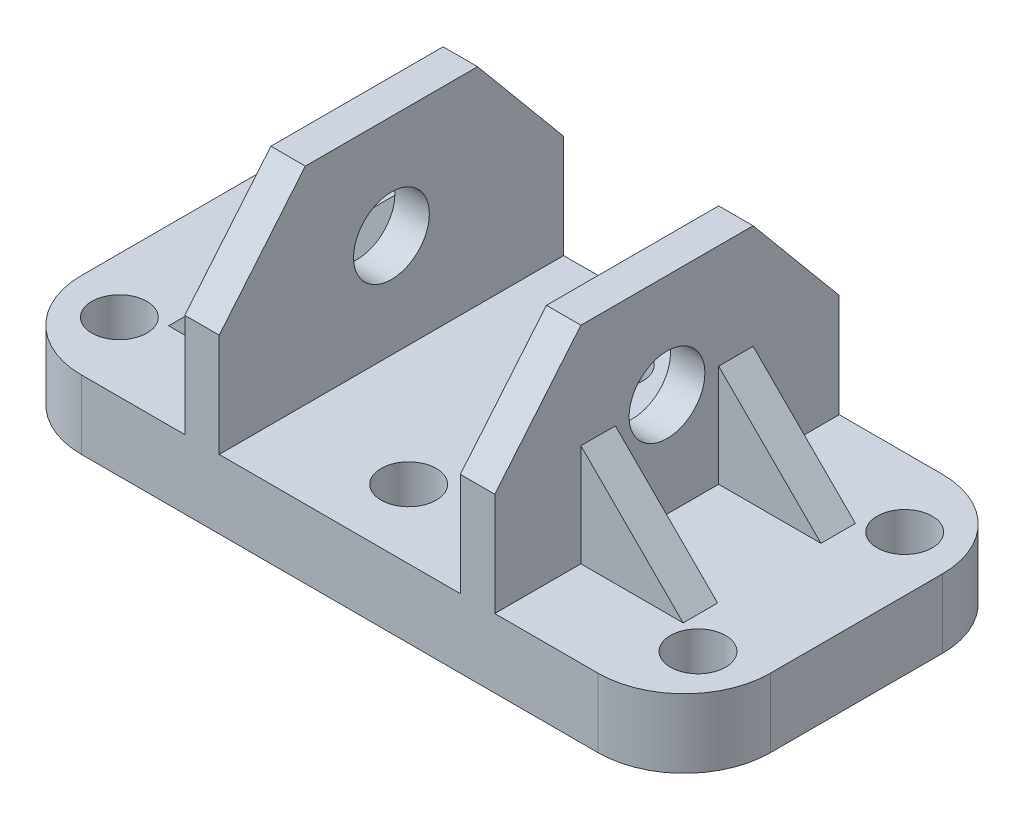
from build123d import *
from OCP.BRepFilletAPI import BRepFilletAPI_MakeChamfer

# Parameters (mm, degrees)
SKETCH2_W           = 200
SKETCH2_H           = 100
BOSS_EXTRUDE1_DEPTH = 20
FILLET1_R           = 25
SKETCH3_R           = 8
CUT_EXTRUDE2_DEPTH  = 20
SKETCH4_W           = 10
SKETCH4_H           = 100
BOSS_EXTRUDE3_DEPTH = 80
CHAMFER1_SIZE       = 30
CHAMFER1_SIZE2      = 25
SKETCH5_R           = 11
CUT_EXTRUDE3_DEPTH  = 127
SKETCH8_W           = 30.69541184
SKETCH8_H           = 10
BOSS_EXTRUDE4_DEPTH = 30
CHAMFER2_SIZE       = 31


with BuildPart() as part:
    # Sketch2 → Boss-Extrude1 (new body)
    with BuildSketch(Plane(origin=(0, 0, 0), x_dir=(1, 0, 0), z_dir=(0, 1, 0))):
        Rectangle(SKETCH2_W, SKETCH2_H)
    extrude(amount=BOSS_EXTRUDE1_DEPTH)

    # Fillet1
    fillet1_edges = [part.edges().sort_by_distance(p)[0] for p in [
        (100, 10, 50),
        (-100, 10, 50),
        (-100, 10, -50),
        (100, 10, -50),
    ]]
    fillet(fillet1_edges, radius=FILLET1_R)

    # Sketch3 → Cut-Extrude2 (cut)
    with BuildSketch(Plane(origin=(0, 20, 0), x_dir=(1, 0, 0), z_dir=(0, 1, 0))):
        with Locations(Location((-84, -30, 0), (0, 0, 270))):
            Circle(SKETCH3_R)
        with Locations(Location((84, -30, 0), (0, 0, 270))):
            Circle(SKETCH3_R)
        with Locations(Location((84, 30, 0), (0, 0, 270))):
            Circle(SKETCH3_R)
        with Locations(Location((-84, 30, 0), (0, 0, 270))):
            Circle(SKETCH3_R)
        with Locations(Location((0, -30, 0), (0, 0, 270))):
            Circle(SKETCH3_R)
        with Locations(Location((0, 30, 0), (0, 0, 270))):
            Circle(SKETCH3_R)
    extrude(amount=-CUT_EXTRUDE2_DEPTH, mode=Mode.SUBTRACT)

    # Sketch4 → Boss-Extrude3 (add)
    with BuildSketch(Plane(origin=(0, 0, 0), x_dir=(1, 0, 0), z_dir=(0, 1, 0))):
        with Locations((-40, 0)):
            Rectangle(SKETCH4_W, SKETCH4_H)
        with Locations((40, 0)):
            Rectangle(SKETCH4_W, SKETCH4_H)
    extrude(amount=BOSS_EXTRUDE3_DEPTH)

    # Chamfer1: one chamfer whose edges measure the first distance from different faces: ONE call of the kernel's chamfer builder (chamfer() names one face for all edges)
    chamfer1_edges_1 = [part.edges().sort_by_distance(p)[0] for p in [
        (40, 80, -50),
        (-40, 80, -50),
    ]]
    chamfer1_side_1 = [part.faces().sort_by_distance(p)[0] for p in [
        (-73.3, 10, -50),
    ]]
    chamfer1_edges_2 = [part.edges().sort_by_distance(p)[0] for p in [
        (40, 80, 50),
        (-40, 80, 50),
    ]]
    chamfer1_side_2 = [part.faces().sort_by_distance(p)[0] for p in [
        (0, 1.7, 50),
    ]]
    chamfer1 = BRepFilletAPI_MakeChamfer(part.part.solid().wrapped)
    for e in chamfer1_edges_1:
        chamfer1.Add(CHAMFER1_SIZE, CHAMFER1_SIZE2, e.wrapped, chamfer1_side_1[0].wrapped)  # the first distance lies on this face
    for e in chamfer1_edges_2:
        chamfer1.Add(CHAMFER1_SIZE, CHAMFER1_SIZE2, e.wrapped, chamfer1_side_2[0].wrapped)  # the first distance lies on this face
    add(Compound.cast(chamfer1.Shape()), mode=Mode.REPLACE)

    # Sketch5 → Cut-Extrude3 (cut)
    with BuildSketch(Plane(origin=(45, 0, 0), x_dir=(0, 0, -1), z_dir=(1, 0, 0))):
        with Locations((0, 50)):
            Circle(SKETCH5_R)
    extrude(amount=-CUT_EXTRUDE3_DEPTH, mode=Mode.SUBTRACT)

    # Sketch8 → Boss-Extrude4 (add)
    with BuildSketch(Plane(origin=(0, 20, 0), x_dir=(1, 0, 0), z_dir=(0, 1, 0))):
        with Locations((60.34770592, -20)):
            Rectangle(SKETCH8_W, SKETCH8_H)
        with Locations((60.34770592, 20)):
            Rectangle(SKETCH8_W, SKETCH8_H)
        with Locations((-60.34770592, -20)):
            Rectangle(SKETCH8_W, SKETCH8_H)
        with Locations((-60.34770592, 20)):
            Rectangle(SKETCH8_W, SKETCH8_H)
    extrude(amount=BOSS_EXTRUDE4_DEPTH)

    # Chamfer2
    # the kernel refuses this chamfer: 31 mm, written as the material it takes off along each edge
    with BuildSketch(Plane(origin=(-75.69541184, 50, 64.722172627), x_dir=(0.9996219169112968, 0.027495876610586407, 0), z_dir=(0, 0, -1))) as chamfer2_piece_1_section:
        Polygon((CHAMFER2_SIZE * 0.999621916911, CHAMFER2_SIZE * 0.0274958766106), (-CHAMFER2_SIZE * 0.0274958766106, CHAMFER2_SIZE * 0.999621916911), (0, 0), align=None)
    chamfer2_piece_1 = extrude(amount=169.444345254, mode=Mode.PRIVATE)
    chamfer2_piece_1 = split(chamfer2_piece_1, bisect_by=Plane(origin=(-45, 39.85641553, -20), z_dir=(-1, 0, 0)), keep=Keep.TOP, mode=Mode.PRIVATE)
    chamfer2_piece_1 = split(chamfer2_piece_1, bisect_by=Plane(origin=(-65.469394976, 20, -20), z_dir=(0, 1, 0)), keep=Keep.TOP, mode=Mode.PRIVATE)
    add(chamfer2_piece_1, mode=Mode.SUBTRACT)
    with BuildSketch(Plane(origin=(-75.69541184, 50, -64.722172627), x_dir=(0.9996219169112968, 0.027495876610586407, 0), z_dir=(0, 0, 1))) as chamfer2_piece_2_section:
        Polygon((CHAMFER2_SIZE * 0.999621916911, -CHAMFER2_SIZE * 0.0274958766106), (-CHAMFER2_SIZE * 0.0274958766106, -CHAMFER2_SIZE * 0.999621916911), (0, 0), align=None)
    chamfer2_piece_2 = extrude(amount=169.444345254, mode=Mode.PRIVATE)
    chamfer2_piece_2 = split(chamfer2_piece_2, bisect_by=Plane(origin=(-45, 39.85641553, 20), z_dir=(-1, 0, 0)), keep=Keep.TOP, mode=Mode.PRIVATE)
    chamfer2_piece_2 = split(chamfer2_piece_2, bisect_by=Plane(origin=(-65.469394976, 20, 20), z_dir=(0, 1, 0)), keep=Keep.TOP, mode=Mode.PRIVATE)
    add(chamfer2_piece_2, mode=Mode.SUBTRACT)
    with BuildSketch(Plane(origin=(75.69541184, 50, 64.722172627), x_dir=(0.02749587661058618, -0.9996219169112968, 0), z_dir=(0, 0, -1))) as chamfer2_piece_3_section:
        Polygon((CHAMFER2_SIZE * 0.999621916911, CHAMFER2_SIZE * 0.0274958766106), (-CHAMFER2_SIZE * 0.0274958766106, CHAMFER2_SIZE * 0.999621916911), (0, 0), align=None)
    chamfer2_piece_3 = extrude(amount=169.444345254, mode=Mode.PRIVATE)
    chamfer2_piece_3 = split(chamfer2_piece_3, bisect_by=Plane(origin=(65.469394976, 20, -20), z_dir=(0, 1, 0)), keep=Keep.TOP, mode=Mode.PRIVATE)
    chamfer2_piece_3 = split(chamfer2_piece_3, bisect_by=Plane(origin=(45, 39.85641553, -20), z_dir=(1, 0, 0)), keep=Keep.TOP, mode=Mode.PRIVATE)
    add(chamfer2_piece_3, mode=Mode.SUBTRACT)
    with BuildSketch(Plane(origin=(75.69541184, 50, 104.722172627), x_dir=(0.02749587661058618, -0.9996219169112968, 0), z_dir=(0, 0, -1))) as chamfer2_piece_4_section:
        Polygon((CHAMFER2_SIZE * 0.999621916911, CHAMFER2_SIZE * 0.0274958766106), (-CHAMFER2_SIZE * 0.0274958766106, CHAMFER2_SIZE * 0.999621916911), (0, 0), align=None)
    chamfer2_piece_4 = extrude(amount=169.444345254, mode=Mode.PRIVATE)
    chamfer2_piece_4 = split(chamfer2_piece_4, bisect_by=Plane(origin=(65.469394976, 20, 20), z_dir=(0, 1, 0)), keep=Keep.TOP, mode=Mode.PRIVATE)
    chamfer2_piece_4 = split(chamfer2_piece_4, bisect_by=Plane(origin=(45, 39.85641553, 20), z_dir=(1, 0, 0)), keep=Keep.TOP, mode=Mode.PRIVATE)
    add(chamfer2_piece_4, mode=Mode.SUBTRACT)


solid = part.part
